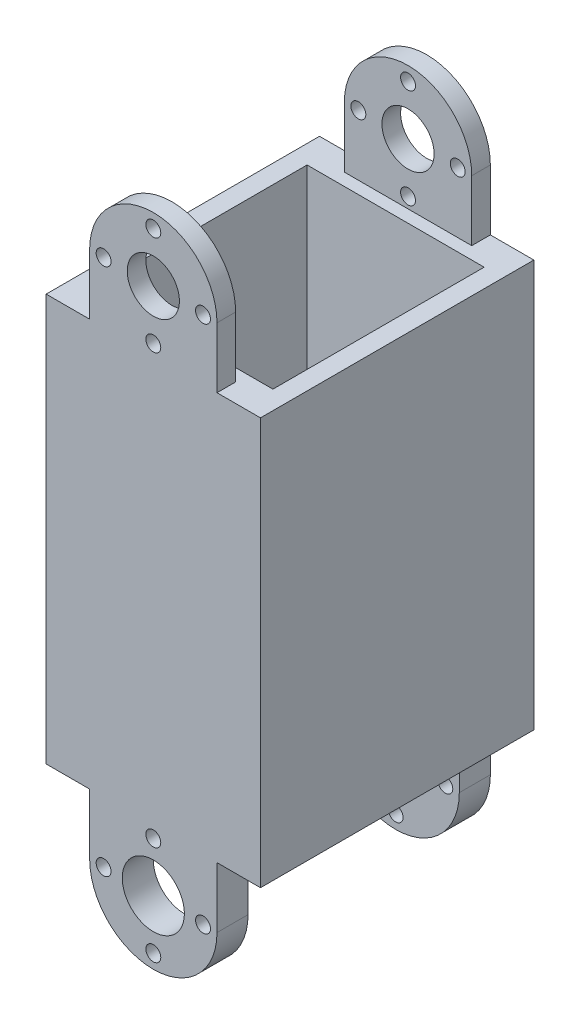
from build123d import *

# Parameters (mm, degrees)
BOSS_EXTRUDE1_DEPTH      = 22
BOSS_EXTRUDE1_DEPTH_BACK = 22
SKETCH1_R                = 1.2
SKETCH1_R_2              = 4.2
SKETCH2_W                = 38
SKETCH2_H                = 20
CUT_EXTRUDE1_DEPTH       = 105.423416914
SKETCH3_W                = 7
SKETCH3_H                = 44
BOSS_EXTRUDE2_DEPTH      = 65.5
SKETCH23_R               = 5
SKETCH23_R_2             = 1.2
CUT_EXTRUDE2_DEPTH       = 111.605436123
SKETCH24_W               = 28.5
SKETCH24_H               = 34
CUT_EXTRUDE3_DEPTH       = 90.954502389
SKETCH25_R               = 5
CUT_EXTRUDE5_DEPTH       = 10


with BuildPart() as part:
    # Sketch1 → Boss-Extrude1 (new, two sides: drawn at the far end of the back side and taken through both)
    with BuildSketch(Plane.XY.offset(-BOSS_EXTRUDE1_DEPTH_BACK)):
        with BuildLine():
            ThreePointArc((10.25, 0), (0, 10.25), (-10.25, 0))
            Line((-10.25, 0), (-10.25, -100))
            Line((-10.25, -100), (10.25, -100))
            Line((10.25, -100), (10.25, 0))
        make_face()
        with Locations((8, 0)):
            Circle(SKETCH1_R, mode=Mode.SUBTRACT)
        with Locations((0, 8)):
            Circle(SKETCH1_R, mode=Mode.SUBTRACT)
        with Locations((-8, 0)):
            Circle(SKETCH1_R, mode=Mode.SUBTRACT)
        Circle(SKETCH1_R_2, mode=Mode.SUBTRACT)
        with Locations((0, -8)):
            Circle(SKETCH1_R, mode=Mode.SUBTRACT)
    extrude(amount=BOSS_EXTRUDE1_DEPTH + BOSS_EXTRUDE1_DEPTH_BACK)

    # Sketch2 → Cut-Extrude1 (cut, through all)
    with BuildSketch(Plane.ZY.offset(10.25)):
        with Locations((0, 0.25)):
            Rectangle(SKETCH2_W, SKETCH2_H)
    extrude(amount=-CUT_EXTRUDE1_DEPTH, mode=Mode.SUBTRACT)

    # Sketch3 → Boss-Extrude2 (add)
    with BuildSketch(Plane(origin=(0, -9.75, 0), x_dir=(1, 0, 0), z_dir=(0, 1, 0))):
        with Locations((-13.75, 0)):
            Rectangle(SKETCH3_W, SKETCH3_H)
        with Locations((13.75, 0)):
            Rectangle(SKETCH3_W, SKETCH3_H)
    extrude(amount=-BOSS_EXTRUDE2_DEPTH)

    # Sketch23 → Cut-Extrude2 (cut, through all)
    with BuildSketch(Plane.XY.offset(22)):
        with BuildLine():
            Line((-10.25, -100), (10.25, -100))
            Line((10.25, -100), (10.25, -85))
            ThreePointArc((10.25, -85), (0, -95.25), (-10.25, -85))
            Line((-10.25, -85), (-10.25, -100))
        make_face()
        with Locations((0, -85)):
            Circle(SKETCH23_R)
        with Locations((8, -85)):
            Circle(SKETCH23_R_2)
        with Locations((0, -77)):
            Circle(SKETCH23_R_2)
        with Locations((0, -93)):
            Circle(SKETCH23_R_2)
        with Locations((-8, -85)):
            Circle(SKETCH23_R_2)
    extrude(amount=-CUT_EXTRUDE2_DEPTH, mode=Mode.SUBTRACT)

    # Sketch24 → Cut-Extrude3 (cut, through all)
    with BuildSketch(Plane(origin=(0, -9.75, 0), x_dir=(1, 0, 0), z_dir=(0, 1, 0))):
        Rectangle(SKETCH24_W, SKETCH24_H)
    extrude(amount=-CUT_EXTRUDE3_DEPTH, mode=Mode.SUBTRACT)

    # Sketch25 → Cut-Extrude5 (cut)
    with BuildSketch(Plane.ZY.offset(17.25)):
        with Locations((0, -42.5)):
            Circle(SKETCH25_R)
    extrude(amount=-CUT_EXTRUDE5_DEPTH, mode=Mode.SUBTRACT)


solid = part.part
